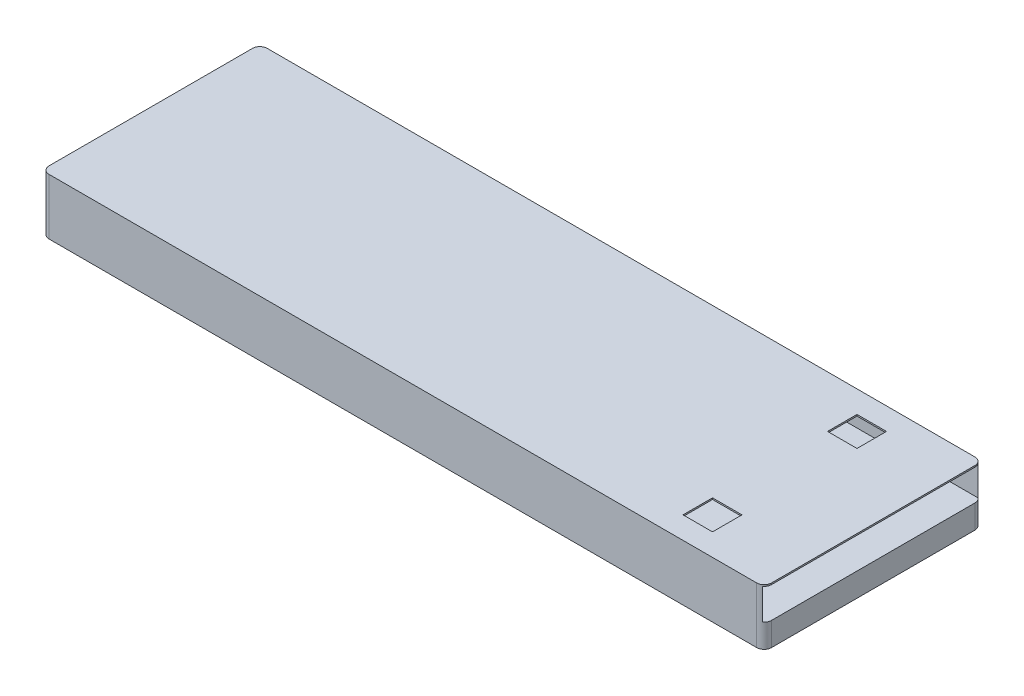
from build123d import *

# Parameters (mm, degrees)
SKETCH1_W           = 49
SKETCH1_H           = 14.8
BOSS_EXTRUDE1_DEPTH = 3.8
SKETCH2_W           = 14.6
SKETCH2_H           = 3.6
CUT_EXTRUDE1_DEPTH  = 48
SKETCH3_W           = 14.6
SKETCH3_H           = 1.5
BOSS_EXTRUDE2_DEPTH = 48
SKETCH5_W           = 2
SKETCH5_H           = 2
CUT_EXTRUDE2_DEPTH  = 2.2
FILLET1_R           = 0.5
SKETCH6_W           = 9
SKETCH6_H           = 7
BOSS_EXTRUDE3_DEPTH = 1.7
FILLET2_R           = 1


with BuildPart() as part:
    # Sketch1 → Boss-Extrude1 (new body)
    with BuildSketch(Plane(origin=(0, 0, 0), x_dir=(1, 0, 0), z_dir=(0, 1, 0))):
        with Locations((-24.5, 7.4)):
            Rectangle(SKETCH1_W, SKETCH1_H)
    extrude(amount=-BOSS_EXTRUDE1_DEPTH)

    # Sketch2 → Cut-Extrude1 (cut)
    with BuildSketch(Plane(origin=(0, 0, 0), x_dir=(0, 0, -1), z_dir=(1, 0, 0))):
        with Locations((7.4, -1.9)):
            Rectangle(SKETCH2_W, SKETCH2_H)
    extrude(amount=-CUT_EXTRUDE1_DEPTH, mode=Mode.SUBTRACT)

    # Sketch3 → Boss-Extrude2 (add)
    with BuildSketch(Plane(origin=(0, 0, 0), x_dir=(0, 0, -1), z_dir=(1, 0, 0))):
        with Locations((7.4, -2.95)):
            Rectangle(SKETCH3_W, SKETCH3_H)
    extrude(amount=-BOSS_EXTRUDE2_DEPTH)

    # Sketch5 → Cut-Extrude2 (cut)
    with BuildSketch(Plane(origin=(0, 0, 0), x_dir=(1, 0, 0), z_dir=(0, 1, 0))):
        with Locations((-6, 12.3)):
            Rectangle(SKETCH5_W, SKETCH5_H)
        with Locations((-6, 2.5)):
            Rectangle(SKETCH5_W, SKETCH5_H)
    extrude(amount=-CUT_EXTRUDE2_DEPTH, mode=Mode.SUBTRACT)

    # Fillet1
    # the kernel refuses this fillet: 0.5 mm, written as the material it takes off along each edge
    with BuildSketch(Plane(origin=(0, 1.25, 0), x_dir=(-1, 0, 0), z_dir=(0, -1, 0)), Plane(origin=(0, 1.25, -14.8), x_dir=(0, 0, 1), z_dir=(0, -1, 0))) as fillet1_piece_1:
        with BuildLine():
            CenterArc((FILLET1_R, FILLET1_R), FILLET1_R, 180, 90)
            Line((0, FILLET1_R), (0, 0))
            Line((0, 0), (FILLET1_R, 0))
        make_face()
    extrude(amount=6.3, mode=Mode.SUBTRACT)
    with BuildSketch(Plane(origin=(-49, 1.25, -14.8), x_dir=(0, 0, 1), z_dir=(0, -1, 0)), Plane(origin=(-49, 1.25, 0), x_dir=(1, 0, 0), z_dir=(0, -1, 0))) as fillet1_piece_2:
        with BuildLine():
            CenterArc((FILLET1_R, -FILLET1_R), FILLET1_R, 90, 90)
            Line((0, -FILLET1_R), (0, 0))
            Line((0, 0), (FILLET1_R, 0))
        make_face()
    extrude(amount=6.3, mode=Mode.SUBTRACT)

    # Sketch6 → Boss-Extrude3 (add)
    with BuildSketch(Plane.XZ.offset(3.8)):
        with Locations((-29.5, -7.4)):
            Rectangle(SKETCH6_W, SKETCH6_H)
    extrude(amount=BOSS_EXTRUDE3_DEPTH)

    # Fillet2
    fillet2_edges = [part.edges().sort_by_distance(p)[0] for p in [
        (-34, -5.5, -7.4),
        (-29.5, -5.5, -10.9),
        (-25, -5.5, -7.4),
        (-29.5, -5.5, -3.9),
    ]]
    fillet(fillet2_edges, radius=FILLET2_R)


solid = part.part
